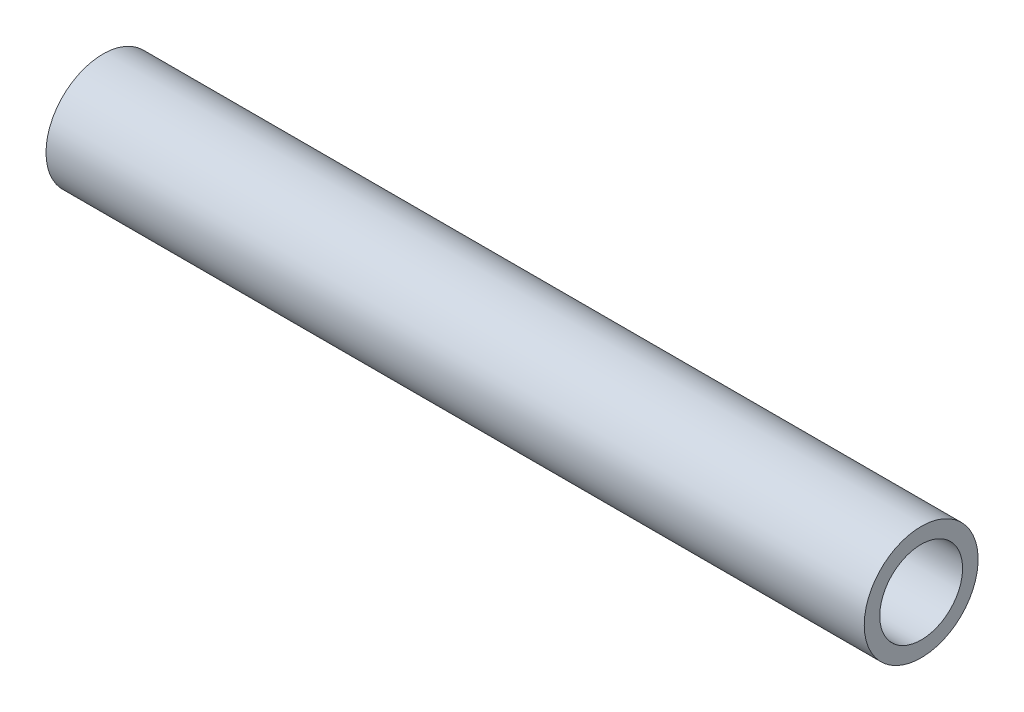
from build123d import *

# Parameters (mm, degrees)
CROQUIS1_R              = 16.7
CROQUIS1_R_2            = 12.15
SALIENTE_EXTRUIR1_DEPTH = 240


with BuildPart() as part:
    # Croquis1 → Saliente-Extruir1 (new body)
    with BuildSketch(Plane(origin=(0, 0, 0), x_dir=(0, 0, -1), z_dir=(1, 0, 0))):
        Circle(CROQUIS1_R)
        Circle(CROQUIS1_R_2, mode=Mode.SUBTRACT)
    extrude(amount=SALIENTE_EXTRUIR1_DEPTH)


solid = part.part
